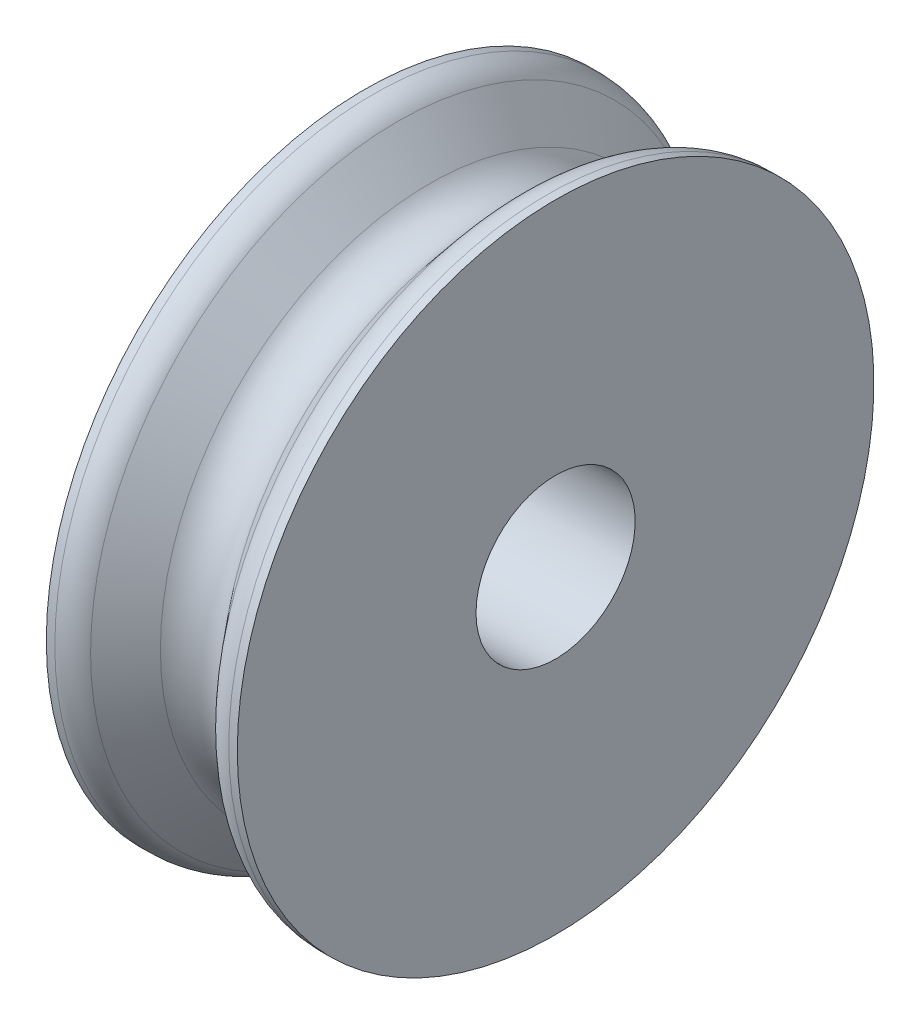
from build123d import *
from build123d.topology import SkipClean

# Parameters (mm, degrees)
FILLET1_R = 5


with BuildPart() as part:
    # Sketch1 → Revolve1 (revolve)
    with BuildSketch(Plane.XY):
        with BuildLine():
            Line((-11.328734558, 50), (-15, 50))
            Line((-15, 50), (-15, 12.5))
            Line((-15, 12.5), (0, 12.5))
            Line((0, 12.5), (0, 40))
            ThreePointArc((0, 40), (-2.662495049, 40.590260942), (-4.826079992, 42.250438059))
            Line((-4.826079992, 42.250438059), (-11.328734558, 50))
        make_face()
    revolve1 = revolve(axis=Axis((-75.888260409, 0, 0), (1, 0, 0)))

    # Mirror1: Revolve1 across plane
    with SkipClean():  # the faces are left unmerged after this step: merging them gives an invalid solid
        add(revolve1.mirror(Plane(origin=(0, 12.5, 0), x_dir=(0, 0, 1), z_dir=(-1, 0, 0))))

    # Fillet1
    fillet1_edges = [part.edges().sort_by_distance(p)[0] for p in [
        (11.328734558, -50, 0),
        (-11.328734558, -50, 0),
    ]]
    fillet(fillet1_edges, radius=FILLET1_R)


solid = part.part
